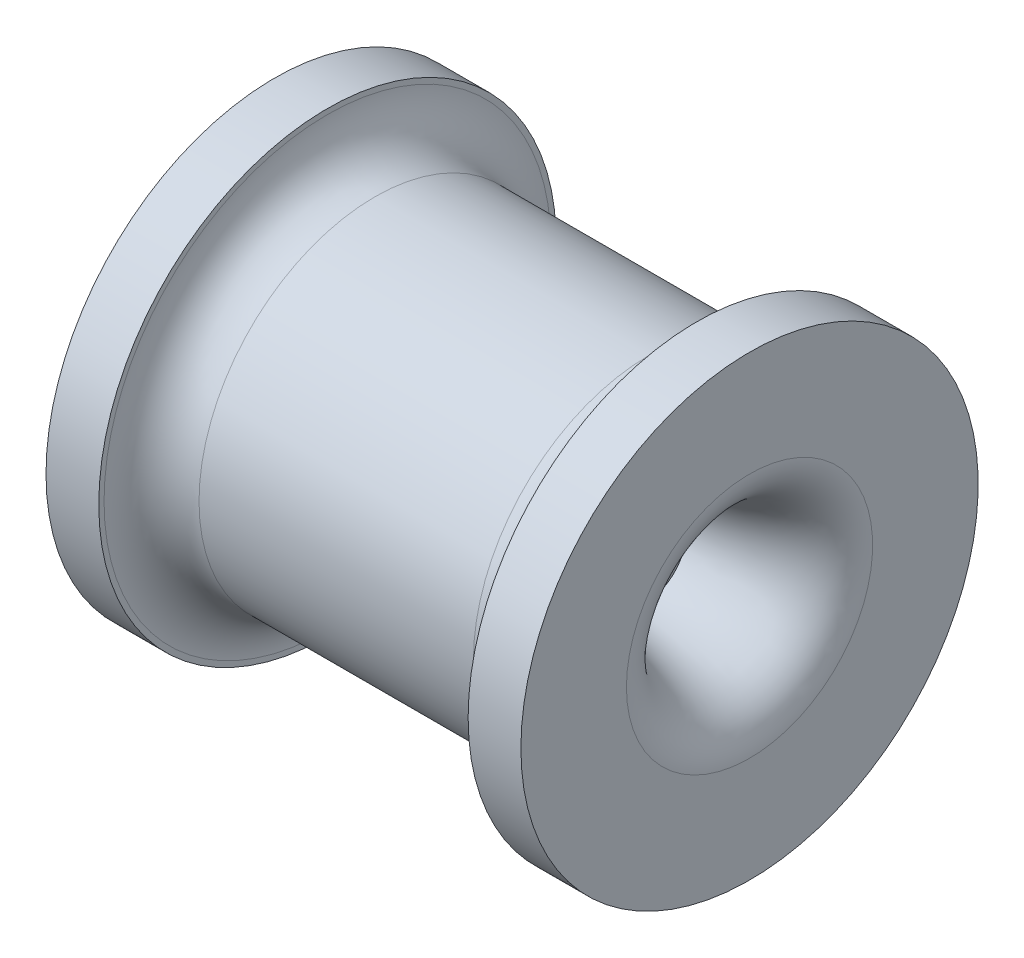
from build123d import *

# Parameters (mm, degrees)
R_VOLUTION3_OUTLINE_W = 12
R_VOLUTION3_OUTLINE_H = 12
ESQUISSE2_R           = 21.001288109
ESQUISSE2_R_2         = 9
BOSS_EXTRU_1_DEPTH    = 80
ESQUISSE3_R           = 11.037807833
BOSS_EXTRU_2_DEPTH    = 5
CONG_1_R              = 4


# Read off the part's stored shape, not the designer's step: Révolution3
with BuildPart() as part:
    # Révolution3 outline → Révolution3 (revolve)
    with BuildSketch(Plane.YX):
        with BuildLine():
            add(Edge.make_bspline(
                [(9, 0), (9.053826316, 3.507535605), (9.211693628, 27.185630898), (15.14970787, 42)],
                knots=[0, 0, 0, 0, 0.679566397, 0.679566397, 0.679566397, 0.679566397], degree=3))
            Line((9, 0), (21.001288109, 0))
            Line((21.001288109, 0), (21.001288109, 42))
            Line((21.001288109, 42), (15.14970787, 42))
        make_face()
        with BuildLine():
            add(Edge.make_bspline(
                [(15.14970787, 42), (16.682530626, 45.824140722), (18.600512592, 49.057648401), (21.001288109, 51.201106105)],
                knots=[0.679566397, 0.679566397, 0.679566397, 0.679566397, 0.854987808, 0.854987808, 0.854987808, 0.854987808], degree=3))
            Line((15.14970787, 42), (21.001288109, 42))
            Line((21.001288109, 42), (21.001288109, 51.201106105))
        make_face()
        with BuildLine():
            Line((21.001288109, 42), (21.001288109, 0))
            add(Edge.make_bspline(
                [(28, 42), (27.997779305, 41.997025444), (27.875050115, 41.83237842), (27.609034397, 41.447212382), (27.160528215, 40.690969165), (26.526197616, 39.457776411), (25.708310332, 37.527019057), (24.777928166, 34.714134126), (23.942034299, 31.528478566), (22.978703398, 26.934375104), (22.072778857, 20.805167001), (21.526924747, 14.790080699), (21.257611914, 10.390059795), (21.125442102, 7.378245527), (21.048712817, 4.734783543), (21.018586389, 2.904179393), (21.007225123, 1.69657239), (21.003198587, 0.929954604), (21.001909089, 0.369945076), (21.0015083, 0.102272875), (21.001288109, 0)],
                knots=[0.198795247, 0.198795247, 0.198795247, 0.198795247, 0.199272098, 0.22510203, 0.250931963, 0.276761895, 0.32842176, 0.380081624, 0.431741489, 0.483401354, 0.586721083, 0.690040812, 0.741700677, 0.793360541, 0.845020406, 0.896680271, 0.922510203, 0.948340135, 0.974170068, 0.990325422, 0.990325422, 0.990325422, 0.990325422], degree=3))
            Line((28, 42), (21.001288109, 42))
        make_face()
        with BuildLine():
            add(Edge.make_bspline(
                [(21.001288109, 51.201106105), (22.985890317, 52.972996421), (25.300409981, 54), (28, 54)],
                knots=[0.854987808, 0.854987808, 0.854987808, 0.854987808, 1, 1, 1, 1], degree=3))
            Line((21.001288109, 51.201106105), (21.001288109, 42))
            Line((21.001288109, 42), (28, 42))
            Line((28, 42), (28, 54))
        make_face()
        Polygon((40, 42), (28, 42), (28, 0), (40, 0), (40, 31.2), align=None)
        with Locations((34, 48)):
            Rectangle(R_VOLUTION3_OUTLINE_W, R_VOLUTION3_OUTLINE_H)
        Polygon((40, 0), (28, 0), (28, -54), (40, -54), (40, -31.2), align=None)
        with BuildLine():
            Line((50.8, 42), (40, 42))
            Line((40, 42), (40, 31.2))
            ThreePointArc((40, 31.2), (43.163246763, 38.836753237), (50.8, 42))
        make_face()
        Polygon((40, 54), (40, 42), (50.8, 42), (52, 42), (52, 54), align=None)
        with BuildLine():
            Line((40, -31.2), (40, -54))
            Line((40, -54), (52, -54))
            Line((52, -54), (52, -42))
            Line((52, -42), (50.8, -42))
            ThreePointArc((50.8, -42), (43.163246763, -38.836753237), (40, -31.2))
        make_face()
    revolve(axis=Axis((0, 0, 0), (1, 0, 0)))

    # Esquisse2 → Boss.-Extru.1 (add)
    with BuildSketch(Plane.ZY.offset(54)):
        Circle(ESQUISSE2_R)
        Circle(ESQUISSE2_R_2, mode=Mode.SUBTRACT)
    extrude(amount=-BOSS_EXTRU_1_DEPTH)

    # Esquisse3 → Boss.-Extru.2 (add)
    with BuildSketch(Plane(origin=(26, 0, 0), x_dir=(0, 0, -1), z_dir=(1, 0, 0))):
        with Locations(Location((0, 0, 0), (0, 0, 180))):
            Circle(ESQUISSE3_R)
    extrude(amount=BOSS_EXTRU_2_DEPTH)

    # Congé1
    cong_1_edges = [part.edges().sort_by_distance(p)[0] for p in [
        (31, 0, -11.037807833),
    ]]
    fillet(cong_1_edges, radius=CONG_1_R)


solid = part.part
